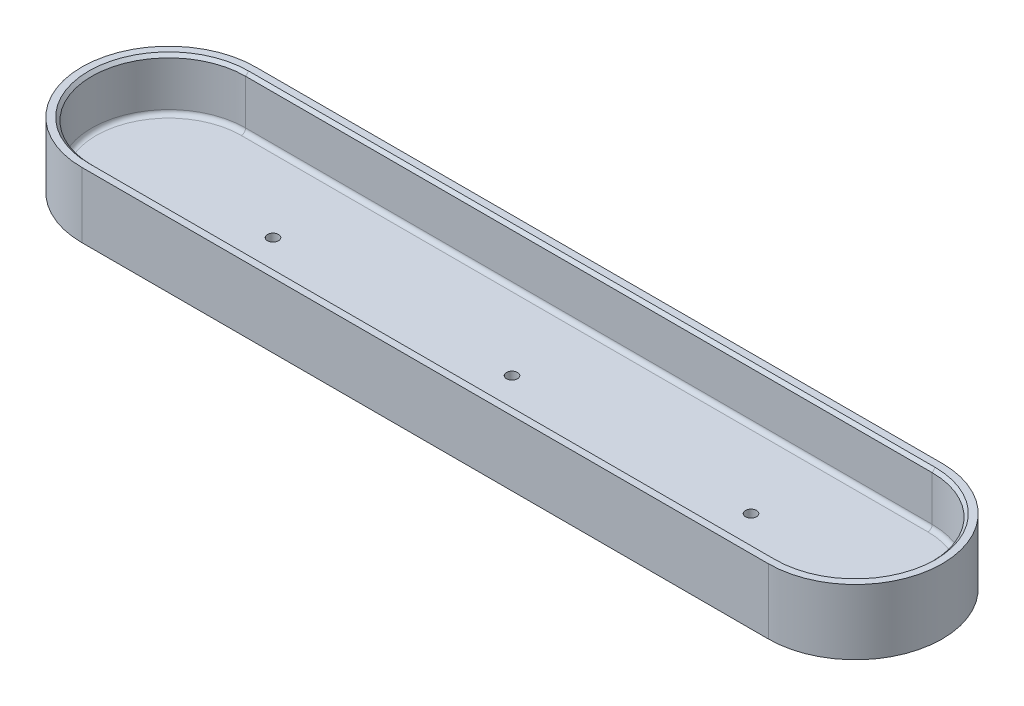
from build123d import *

# Parameters (mm, degrees)
MAINBLOCK_DEPTH     = 3.81
BOSS_EXTRUDE1_DEPTH = 19.05
SKETCH3_R           = 1.6129
CUT_EXTRUDE1_DEPTH  = 130.676888457
FILLET1_R           = 1.27
CHAMFER1_SIZE       = 0.889


with BuildPart() as part:
    # Sketch1 → MainBlock (new body)
    with BuildSketch(Plane(origin=(0, 0, 0), x_dir=(1, 0, 0), z_dir=(0, 1, 0))):
        with BuildLine():
            Line((-100.33, 22.479), (100.33, 22.479))
            ThreePointArc((100.33, 22.479), (122.809, 0), (100.33, -22.479))
            Line((100.33, -22.479), (-100.33, -22.479))
            ThreePointArc((-100.33, -22.479), (-122.809, 0), (-100.33, 22.479))
        make_face()
    extrude(amount=MAINBLOCK_DEPTH)

    # Sketch2 → Boss-Extrude1 (add)
    with BuildSketch(Plane.XZ):
        with BuildLine():
            Line((-100.33, 25.4), (100.33, 25.4))
            ThreePointArc((100.33, 25.4), (125.73, 0), (100.33, -25.4))
            Line((100.33, -25.4), (-100.33, -25.4))
            ThreePointArc((-100.33, -25.4), (-125.73, 0), (-100.33, 25.4))
        make_face()
        with BuildLine():
            Line((100.33, 22.479), (-100.33, 22.479))
            ThreePointArc((-100.33, 22.479), (-122.809, 0), (-100.33, -22.479))
            Line((-100.33, -22.479), (100.33, -22.479))
            ThreePointArc((100.33, -22.479), (122.809, 0), (100.33, 22.479))
        make_face(mode=Mode.SUBTRACT)
    extrude(amount=-BOSS_EXTRUDE1_DEPTH)

    # Sketch3 → Cut-Extrude1 (cut, through all)
    with BuildSketch(Plane.XZ):
        Circle(SKETCH3_R)
        with Locations((-69.85, 0)):
            Circle(SKETCH3_R)
        with Locations((69.85, 0)):
            Circle(SKETCH3_R)
    extrude(amount=-CUT_EXTRUDE1_DEPTH, mode=Mode.SUBTRACT)

    # Fillet1
    fillet1_edges = [part.edges().sort_by_distance(p)[0] for p in [
        (122.809, 3.81, 0),
        (0, 3.81, 22.479),
        (-122.809, 3.81, 0),
        (0, 3.81, -22.479),
    ]]
    fillet(fillet1_edges, radius=FILLET1_R)

    # Chamfer1
    chamfer1_edges = [part.edges().sort_by_distance(p)[0] for p in [
        (0, 19.05, 22.479),
        (-122.809, 19.05, 0),
        (122.809, 19.05, 0),
        (0, 19.05, -22.479),
    ]]
    chamfer(chamfer1_edges, length=CHAMFER1_SIZE)


solid = part.part
